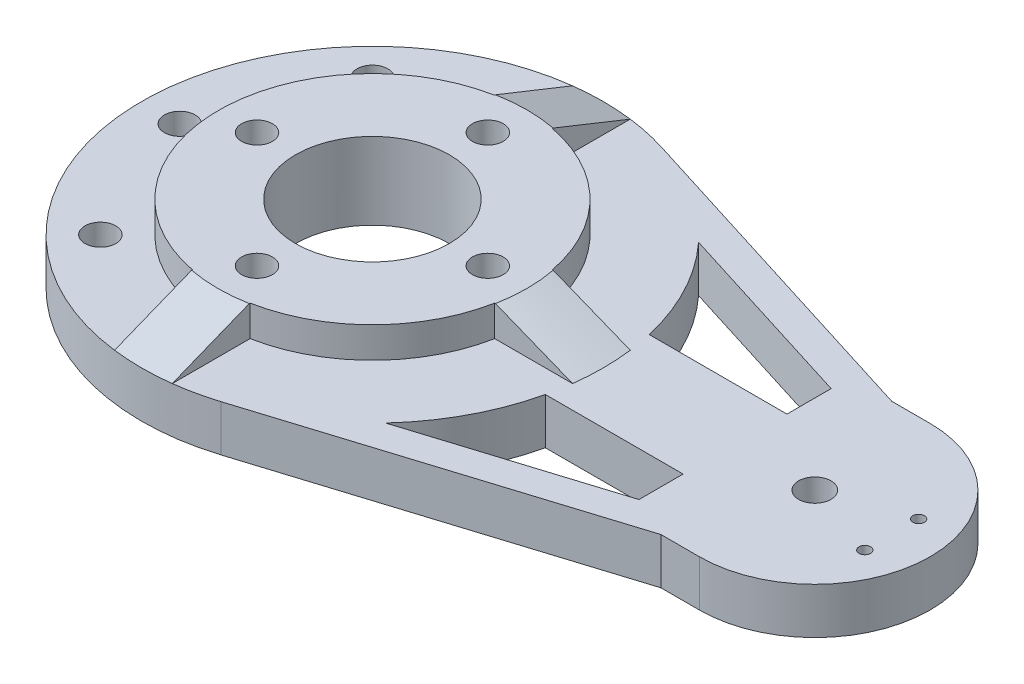
from build123d import *
from OCP.BRepFilletAPI import BRepFilletAPI_MakeChamfer
from build123d.topology import SkipClean

# Parameters (mm, degrees)
SKETCH1_R           = 40
SKETCH1_R_2         = 20
BOSS_EXTRUDE1_DEPTH = 8
BOSS_EXTRUDE2_START = 12
SKETCH3_R           = 20
BOSS_EXTRUDE2_DEPTH = 12
SKETCH5_R           = 7.5
CUT_EXTRUDE3_DEPTH  = 10
SKETCH2_R           = 4
CUT_EXTRUDE1_DEPTH  = 20
BOSS_EXTRUDE3_DEPTH = 8
CHAMFER1_SIZE       = 19.800694827
CHAMFER1_SIZE_2     = 8
BOSS_EXTRUDE4_DEPTH = 12
CUT_EXTRUDE4_DEPTH  = 6
SKETCH9_R           = 4.2
CUT_EXTRUDE5_DEPTH  = 6
CUT_EXTRUDE7_START  = -12
CUT_EXTRUDE7_DEPTH  = 12
SKETCH_1_R          = 4
CUT_EXTRUDE_1_DEPTH = 158.381701605
SKETCH_2_R          = 1.5
CUT_EXTRUDE_2_DEPTH = 158.381701605
CUT_EXTRUDE_3_DEPTH = 3.5
SKETCH_1_4_R        = 4
CUT_EXTRUDE_4_DEPTH = 158.381701605


with BuildPart() as part:
    # Sketch1 → Boss-Extrude1 (new body)
    with BuildSketch(Plane(origin=(0, 0, 0), x_dir=(1, 0, 0), z_dir=(0, 1, 0))):
        with Locations(Location((0, 0, 0), (0, 0, 270))):
            Circle(SKETCH1_R)
        with Locations(Location((0, 0, 0), (0, 0, 270))):
            Circle(SKETCH1_R_2, mode=Mode.SUBTRACT)
    extrude(amount=BOSS_EXTRUDE1_DEPTH)

    # Sketch3 → Boss-Extrude2 (add)
    with SkipClean():  # the faces are left unmerged after this step: merging them gives an invalid solid
        with BuildSketch(Plane.XZ.offset(BOSS_EXTRUDE2_START)):
            with BuildLine():
                Line((17.925820686, 57.259627599), (105, 30))
                Line((105, 30), (105, -30))
                Line((105, -30), (17.925820686, -57.259627599))
                ThreePointArc((17.925820686, -57.259627599), (-60, 0), (17.925820686, 57.259627599))
            make_face()
            with Locations(Location((0, 0, 0), (0, 0, 270))):
                Circle(SKETCH3_R, mode=Mode.SUBTRACT)
        extrude(amount=-BOSS_EXTRUDE2_DEPTH)

    # Sketch5 → Cut-Extrude3 (cut)
    with SkipClean():  # the faces are left unmerged after this step: merging them gives an invalid solid
        with BuildSketch(Plane.XZ.offset(12)):
            with Locations(Location((0, 30, 0), (0, 0, 270))):
                Circle(SKETCH5_R)
            with Locations(Location((30, 0, 0), (0, 0, 270))):
                Circle(SKETCH5_R)
            with Locations(Location((0, -30, 0), (0, 0, 270))):
                Circle(SKETCH5_R)
            with Locations(Location((-30, 0, 0), (0, 0, 270))):
                Circle(SKETCH5_R)
        extrude(amount=-CUT_EXTRUDE3_DEPTH, mode=Mode.SUBTRACT)

    # Sketch2 → Cut-Extrude1 (cut)
    with SkipClean():  # the faces are left unmerged after this step: merging them gives an invalid solid
        with BuildSketch(Plane(origin=(0, 8, 0), x_dir=(1, 0, 0), z_dir=(0, 1, 0))):
            with Locations(Location((30, 0, 0), (0, 0, 270))):
                Circle(SKETCH2_R)
            with Locations(Location((0, -30, 0), (0, 0, 270))):
                Circle(SKETCH2_R)
            with Locations(Location((-30, 0, 0), (0, 0, 270))):
                Circle(SKETCH2_R)
            with Locations(Location((0, 30, 0), (0, 0, 270))):
                Circle(SKETCH2_R)
        extrude(amount=-CUT_EXTRUDE1_DEPTH, mode=Mode.SUBTRACT)

    # Sketch6 → Boss-Extrude3 (add)
    with SkipClean():  # the faces are left unmerged after this step: merging them gives an invalid solid
        with BuildSketch(Plane(origin=(0, 0, 0), x_dir=(1, 0, 0), z_dir=(0, 1, 0))):
            with BuildLine():
                Line((-7.5, -39.290584114), (-7.5, -59.529404499))
                ThreePointArc((-7.5, -59.529404499), (0, -60), (7.5, -59.529404499))
                Line((7.5, -59.529404499), (7.5, -39.290584114))
                ThreePointArc((7.5, -39.290584114), (0, -40), (-7.5, -39.290584114))
            make_face()
            with BuildLine():
                Line((-7.5, 39.290584114), (-7.5, 59.529404499))
                ThreePointArc((-7.5, 59.529404499), (0, 60), (7.5, 59.529404499))
                Line((7.5, 59.529404499), (7.5, 39.290584114))
                ThreePointArc((7.5, 39.290584114), (0, 40), (-7.5, 39.290584114))
            make_face()
            with BuildLine():
                Line((39.290584114, 7.5), (59.529404499, 7.5))
                ThreePointArc((59.529404499, 7.5), (60, 0), (59.529404499, -7.5))
                Line((59.529404499, -7.5), (39.290584114, -7.5))
                ThreePointArc((39.290584114, -7.5), (40, 0), (39.290584114, 7.5))
            make_face()
        extrude(amount=BOSS_EXTRUDE3_DEPTH)

    # Chamfer1
    chamfer1_edges_1 = [part.edges().sort_by_distance(p)[0] for p in [
        (0, 8, -60),
    ]]
    chamfer1_side_1 = [part.faces().sort_by_distance(p)[0] for p in [
        (0, 8, -59.84),
    ]]
    chamfer1_edges_2 = [part.edges().sort_by_distance(p)[0] for p in [
        (60, 8, 0),
    ]]
    chamfer1_side_2 = [part.faces().sort_by_distance(p)[0] for p in [
        (60, 7.84, 0),
    ]]
    chamfer1_edges_3 = [part.edges().sort_by_distance(p)[0] for p in [
        (0, 8, 60),
    ]]
    chamfer1_side_3 = [part.faces().sort_by_distance(p)[0] for p in [
        (0, 8, 59.84),
    ]]
    chamfer1 = BRepFilletAPI_MakeChamfer(part.part.solid().wrapped)
    for e in chamfer1_edges_1:
        chamfer1.Add(CHAMFER1_SIZE - 0.0001, CHAMFER1_SIZE_2 - 0.0001, e.wrapped, chamfer1_side_1[0].wrapped)
    for e in chamfer1_edges_2:
        chamfer1.Add(CHAMFER1_SIZE_2 - 0.0001, CHAMFER1_SIZE - 0.0001, e.wrapped, chamfer1_side_2[0].wrapped)
    for e in chamfer1_edges_3:
        chamfer1.Add(CHAMFER1_SIZE - 0.0001, CHAMFER1_SIZE_2 - 0.0001, e.wrapped, chamfer1_side_3[0].wrapped)
    add(Compound.cast(chamfer1.Shape()), mode=Mode.REPLACE)  # a hair under: the kernel refuses the full size

    # Sketch7 → Boss-Extrude4 (add)
    with BuildSketch(Plane.XZ.offset(12)):
        with BuildLine():
            Line((115, 30), (105, 30))
            Line((105, 30), (105, -30))
            Line((105, -30), (115, -30))
            ThreePointArc((115, -30), (145, 0), (115, 30))
        make_face()
    extrude(amount=-BOSS_EXTRUDE4_DEPTH)

    # Sketch8 → Cut-Extrude4 (cut)
    with BuildSketch(Plane.XZ.offset(12)):
        Polygon((111.24722325, -6.5), (118.75277675, -6.5), (122.505553499, 0), (118.75277675, 6.5), (111.24722325, 6.5), (107.494446501, 0), align=None)
    extrude(amount=-CUT_EXTRUDE4_DEPTH, mode=Mode.SUBTRACT)

    # Sketch9 → Cut-Extrude5 (cut)
    with BuildSketch(Plane.XZ.offset(6)):
        with Locations(Location((115, 0, 0), (0, 0, 270))):
            Circle(SKETCH9_R)
    extrude(amount=-CUT_EXTRUDE5_DEPTH, mode=Mode.SUBTRACT)

    # Sketch11 → Cut-Extrude7 (cut)
    with BuildSketch(Plane(origin=(0, 0, 0), x_dir=(1, 0, 0), z_dir=(0, 1, 0)).offset(CUT_EXTRUDE7_START)):
        with BuildLine():
            Line((94.268829829, 24.976653188), (94.268829829, 13.5))
            Line((94.268829829, 13.5), (58.46152581, 13.5))
            ThreePointArc((58.46152581, 13.5), (53.052110577, 28.026301278), (44.101832404, 40.682040001))
            Line((44.101832404, 40.682040001), (94.268829829, 24.976653188))
        make_face()
    cut_extrude7 = extrude(amount=CUT_EXTRUDE7_DEPTH, mode=Mode.SUBTRACT)

    # Mirror1: Cut-Extrude7 across plane
    add(cut_extrude7.mirror(Plane.XY), mode=Mode.SUBTRACT)

    # 草图1 → 切除-拉伸1 (cut, through all)
    with BuildSketch(Plane(origin=(0, 0, 0), x_dir=(1, 0, 0), z_dir=(0, 1, 0))):
        with Locations(Location((-35.355339059, 35.355339059, 0), (0, 0, 270))):
            Circle(SKETCH_1_R)
        with Locations(Location((-35.355339059, -35.355339059, 0), (0, 0, 270))):
            Circle(SKETCH_1_R)
    extrude(amount=-CUT_EXTRUDE_1_DEPTH, mode=Mode.SUBTRACT)

    # 草图2 → 切除-拉伸2 (cut, through all)
    with BuildSketch(Plane(origin=(0, 0, 0), x_dir=(1, 0, 0), z_dir=(0, 1, 0))):
        with Locations(Location((135, -7, 0), (0, 0, 270))):
            Circle(SKETCH_2_R)
        with Locations(Location((135, 7, 0), (0, 0, 270))):
            Circle(SKETCH_2_R)
    extrude(amount=-CUT_EXTRUDE_2_DEPTH, mode=Mode.SUBTRACT)

    # 草图3 → 切除-拉伸3 (cut)
    with BuildSketch(Plane.XZ.offset(12)):
        Polygon((133.41228676, -9.75), (136.58771324, -9.75), (138.175426481, -7), (136.58771324, -4.25), (133.41228676, -4.25), (131.824573519, -7), align=None)
        Polygon((133.41228676, 4.25), (136.58771324, 4.25), (138.175426481, 7), (136.58771324, 9.75), (133.41228676, 9.75), (131.824573519, 7), align=None)
    extrude(amount=-CUT_EXTRUDE_3_DEPTH, mode=Mode.SUBTRACT)

    # 草图1<4> → 切除-拉伸4 (cut, through all)
    with BuildSketch(Plane(origin=(0, 0, 0), x_dir=(1, 0, 0), z_dir=(0, 1, 0))):
        with Locations(Location((-35.355339059, 35.355339059, 0), (0, 0, 270))):
            Circle(SKETCH_1_4_R)
        with Locations(Location((-35.355339059, -35.355339059, 0), (0, 0, 270))):
            Circle(SKETCH_1_4_R)
        with Locations(Location((-50, -0.068188384, 0), (0, 0, 270))):
            Circle(SKETCH_1_4_R)
    extrude(amount=-CUT_EXTRUDE_4_DEPTH, mode=Mode.SUBTRACT)


solid = part.part
